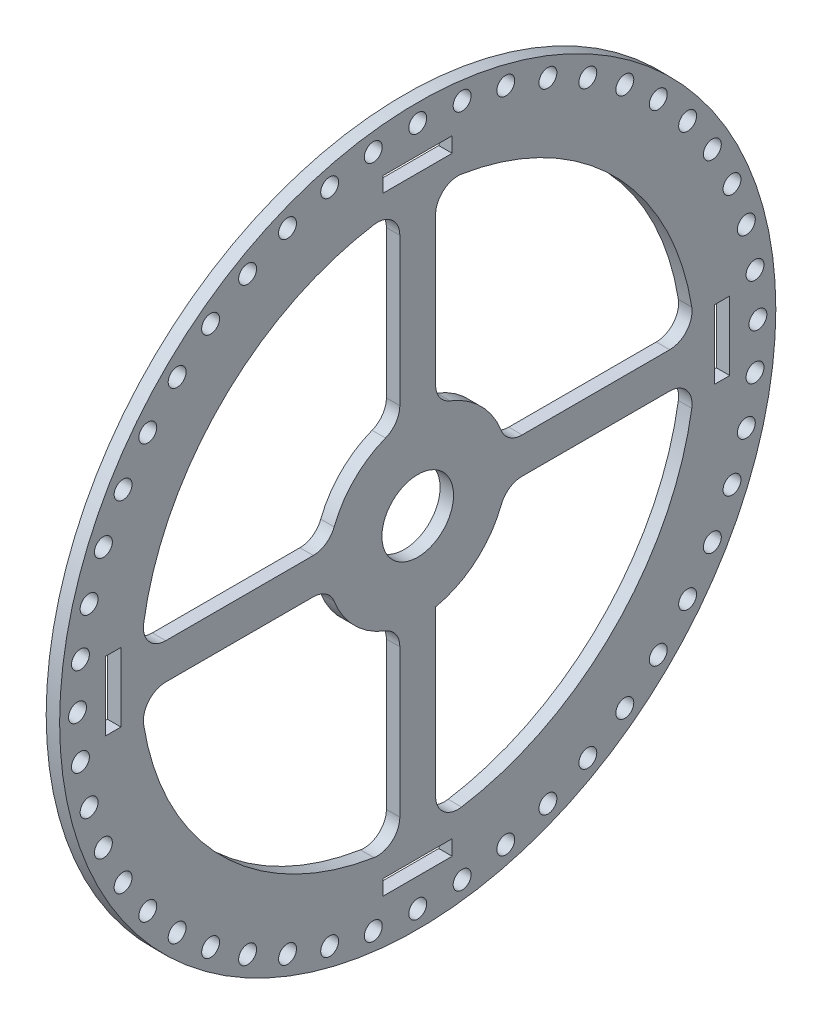
from build123d import *

# Parameters (mm, degrees)
SKETCH3_R           = 40
SKETCH3_R_2         = 4
SKETCH3_W           = 7.7
SKETCH3_H           = 1.7
SKETCH3_W_2         = 1.7
SKETCH3_H_2         = 7.7
BOSS_EXTRUDE2_DEPTH = 1.5
SKETCH4_R           = 1
CUT_EXTRUDE1_DEPTH  = 1.5
CIRPATTERN1_COUNT   = 48
FILLET1_R           = 2.5


with BuildPart() as part:
    # Sketch3 → Boss-Extrude2 (new body)
    with BuildSketch(Plane(origin=(0, 0, 0), x_dir=(0, 0, -1), z_dir=(1, 0, 0))):
        Circle(SKETCH3_R)
        Circle(SKETCH3_R_2, mode=Mode.SUBTRACT)
        with BuildLine():
            Line((9.797958971, 2), (30.935416597, 2))
            ThreePointArc((30.935416597, 2), (21.920310217, 21.920310217), (2, 30.935416597))
            Line((2, 30.935416597), (2, 9.797958971))
            ThreePointArc((2, 9.797958971), (7.071067812, 7.071067812), (9.797958971, 2))
        make_face(mode=Mode.SUBTRACT)
        with BuildLine():
            Line((-30.935416597, 2), (-9.797958971, 2))
            ThreePointArc((-9.797958971, 2), (-7.071067812, 7.071067812), (-2, 9.797958971))
            Line((-2, 9.797958971), (-2, 30.935416597))
            ThreePointArc((-2, 30.935416597), (-21.920310217, 21.920310217), (-30.935416597, 2))
        make_face(mode=Mode.SUBTRACT)
        with BuildLine():
            Line((-30.935416597, -2), (-9.797958971, -2))
            ThreePointArc((-9.797958971, -2), (-7.071067812, -7.071067812), (-2, -9.797958971))
            Line((-2, -9.797958971), (-2, -30.935416597))
            ThreePointArc((-2, -30.935416597), (-21.920310217, -21.920310217), (-30.935416597, -2))
        make_face(mode=Mode.SUBTRACT)
        with BuildLine():
            Line((9.797958971, -2), (30.935416597, -2))
            ThreePointArc((30.935416597, -2), (21.920310217, -21.920310217), (2, -30.935416597))
            Line((2, -30.935416597), (2, -9.797958971))
            ThreePointArc((2, -9.797958971), (7.071067812, -7.071067812), (9.797958971, -2))
        make_face(mode=Mode.SUBTRACT)
        with Locations((0, 34)):
            Rectangle(SKETCH3_W, SKETCH3_H, mode=Mode.SUBTRACT)
        with Locations((34, 0)):
            Rectangle(SKETCH3_W_2, SKETCH3_H_2, mode=Mode.SUBTRACT)
        with Locations((0, -34)):
            Rectangle(SKETCH3_W, SKETCH3_H, mode=Mode.SUBTRACT)
        with Locations((-34, 0)):
            Rectangle(SKETCH3_W_2, SKETCH3_H_2, mode=Mode.SUBTRACT)
    extrude(amount=BOSS_EXTRUDE2_DEPTH)

    # Sketch4 → Cut-Extrude1 (cut)
    with BuildSketch(Plane.ZY):
        with Locations((0, 38)):
            Circle(SKETCH4_R)
    cut_extrude1 = extrude(amount=-CUT_EXTRUDE1_DEPTH, mode=Mode.SUBTRACT)

    # CirPattern1: Cut-Extrude1 ×48 about axis
    cirpattern1_axis = Axis((0, 0, 0), (1, 0, 0))
    for i in range(1, CIRPATTERN1_COUNT):
        add(cut_extrude1.rotate(cirpattern1_axis, i * 360 / CIRPATTERN1_COUNT), mode=Mode.SUBTRACT)

    # Fillet1
    fillet1_edges = [part.edges().sort_by_distance(p)[0] for p in [
        (0.75, -2, 30.935416597),
        (0.75, -30.935416597, 2),
        (0.75, -9.797958971, 2),
        (0.75, -2, 9.797958971),
        (0.75, -30.935416597, -2),
        (0.75, -2, -30.935416597),
        (0.75, 2, -9.797958971),
        (0.75, 2, -30.935416597),
        (0.75, 2, 9.797958971),
        (0.75, 2, 30.935416597),
        (0.75, 9.797958971, 2),
        (0.75, 30.935416597, 2),
        (0.75, 9.797958971, -2),
        (0.75, 30.935416597, -2),
        (0.75, -2, -9.797958971),
    ]]
    fillet(fillet1_edges, radius=FILLET1_R)


solid = part.part
